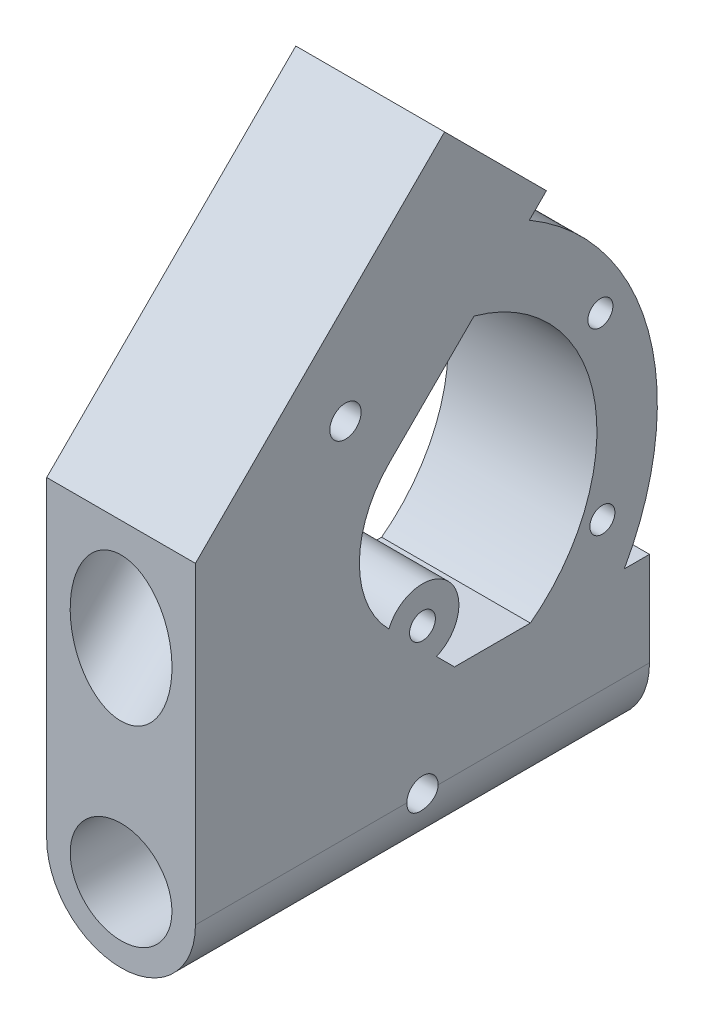
from build123d import *

# Parameters (mm, degrees)
CROQUIS1_R              = 6.5
SALIENTE_EXTRUIR1_DEPTH = 29
SALIENTE_EXTRUIR2_DEPTH = 9.5
CROQUIS3_R              = 6.5
CORTAR_EXTRUIR1_DEPTH   = 73
SALIENTE_EXTRUIR3_DEPTH = 9.5
CROQUIS5_R              = 4.65
CROQUIS5_R_2            = 1.65
SALIENTE_EXTRUIR4_DEPTH = 9.5
CROQUIS6_R              = 1.6
CORTAR_EXTRUIR2_DEPTH   = 15
CROQUIS7_R              = 2
CORTAR_EXTRUIR3_DEPTH   = 26.5


with BuildPart() as part:
    # Croquis1 → Saliente-Extruir1 (new, symmetric)
    with BuildSketch(Plane.XY):
        with BuildLine():
            Line((-9.5, 12), (9.5, 12))
            Line((9.5, 12), (9.5, 0))
            ThreePointArc((9.5, 0), (0, -9.5), (-9.5, 0))
            Line((-9.5, 0), (-9.5, 12))
        make_face()
        Circle(CROQUIS1_R, mode=Mode.SUBTRACT)
    extrude(amount=SALIENTE_EXTRUIR1_DEPTH, both=True)

    # Croquis2 → Saliente-Extruir2 (add, symmetric)
    with BuildSketch(Plane(origin=(0, 0, 0), x_dir=(0, 0, -1), z_dir=(1, 0, 0))):
        with BuildLine():
            Line((-29, 12), (-29, 40))
            Line((-29, 40), (2.819805153, 71.819805153))
            Line((2.819805153, 71.819805153), (15.830569927, 58.80904038))
            Line((15.830569927, 58.80904038), (-4.251796904, 38.726673548))
            ThreePointArc((-4.251796904, 38.726673548), (-8.059408749, 29.534285393), (-4.251796904, 20.341897237))
            Line((-4.251796904, 20.341897237), (4.090100333, 12))
            Line((4.090100333, 12), (-29, 12))
        make_face()
    extrude(amount=SALIENTE_EXTRUIR2_DEPTH, both=True)

    # Croquis3 → Cortar-Extruir1 (cut)
    with BuildSketch(Plane(origin=(0, 37.319805153, -37.319805153), x_dir=(1, 0, 0), z_dir=(0, 0.7071067811865465, -0.7071067811865487))):
        with Locations((0, -39.590367902)):
            Circle(CROQUIS3_R)
    extrude(amount=-CORTAR_EXTRUIR1_DEPTH, mode=Mode.SUBTRACT)

    # Croquis4 → Saliente-Extruir3 (add, symmetric)
    with BuildSketch(Plane(origin=(0, 0, 0), x_dir=(0, 0, -1), z_dir=(1, 0, 0))):
        with BuildLine():
            Line((6.58232419, 49.560794642), (13.653392001, 56.631862454))
            ThreePointArc((13.653392001, 56.631862454), (28.845023505, 36.796295198), (25.782485256, 12))
            Line((25.782485256, 12), (13.782485256, 12))
            ThreePointArc((13.782485256, 12), (21.90502045, 33.027546833), (6.58232419, 49.560794642))
        make_face()
    extrude(amount=SALIENTE_EXTRUIR3_DEPTH, both=True)

    # Croquis5 → Saliente-Extruir4 (add, symmetric)
    with BuildSketch(Plane(origin=(0, 0, 0), x_dir=(0, 0, -1), z_dir=(1, 0, 0))):
        with Locations((0, 18.59255238)):
            Circle(CROQUIS5_R)
        with Locations((0, 18.59255238)):
            Circle(CROQUIS5_R_2, mode=Mode.SUBTRACT)
    extrude(amount=SALIENTE_EXTRUIR4_DEPTH, both=True)

    # Croquis6 → Cortar-Extruir2 (cut, symmetric)
    with BuildSketch(Plane(origin=(0, 0, 0), x_dir=(0, 0, -1), z_dir=(1, 0, 0))):
        with Locations((22.726275042, 41.82542613)):
            Circle(CROQUIS6_R)
        with Locations((22.98, 18.84542613)):
            Circle(CROQUIS6_R)
    extrude(amount=CORTAR_EXTRUIR2_DEPTH, both=True, mode=Mode.SUBTRACT)

    # Croquis7 → Cortar-Extruir3 (cut, symmetric)
    with BuildSketch(Plane(origin=(0, 0, 0), x_dir=(0, 0, -1), z_dir=(1, 0, 0))):
        Circle(CROQUIS7_R)
        with Locations((-9.83740623, 46.151828996)):
            Circle(CROQUIS7_R)
    extrude(amount=CORTAR_EXTRUIR3_DEPTH, both=True, mode=Mode.SUBTRACT)


solid = part.part
